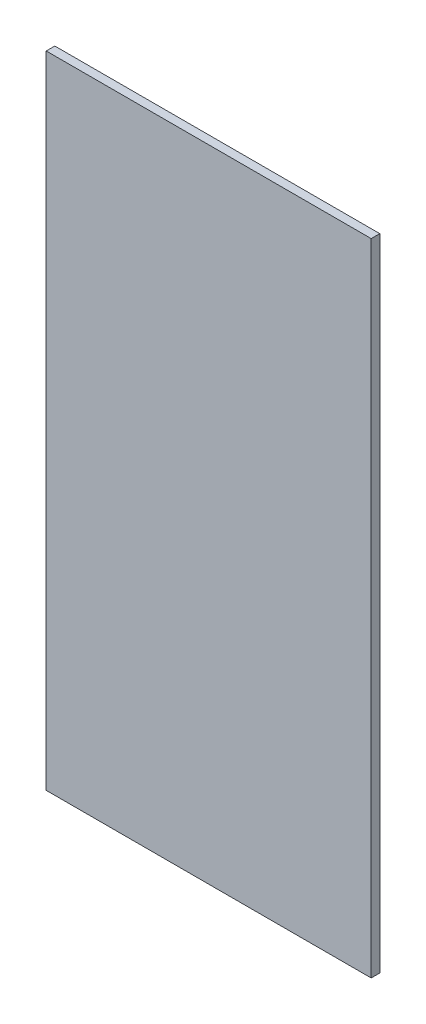
from build123d import *

# Parameters (mm, degrees)
SKETCH1_W           = 120
SKETCH1_H           = 60.9
BOSS_EXTRUDE1_DEPTH = 1.61


with BuildPart() as part:
    # Sketch1 → Boss-Extrude1 (new body)
    with BuildSketch(Plane(origin=(0, 0, 0), x_dir=(0, 1, 0), z_dir=(0, 0, 1))):
        Rectangle(SKETCH1_W, SKETCH1_H)
    extrude(amount=BOSS_EXTRUDE1_DEPTH)


solid = part.part
